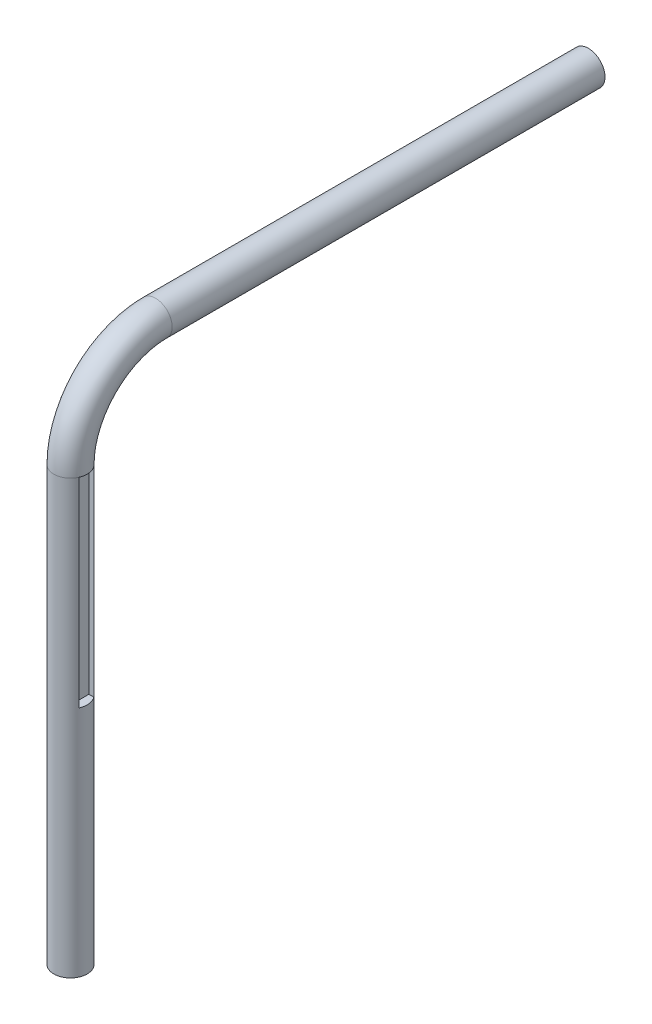
from build123d import *

# Parameters (mm, degrees)
SKETCH3_R           = 12.7
SKETCH3_R_2         = 4.7625
SKETCH4_R           = 12.7
SKETCH4_R_2         = 4.7625
BOSS_EXTRUDE3_DEPTH = 330.2
SKETCH5_R           = 12.7
SKETCH5_R_2         = 4.7625
BOSS_EXTRUDE4_DEPTH = 330.2
SKETCH7_W           = 12.7
SKETCH7_H           = 152.4
CUT_EXTRUDE2_DEPTH  = 6.35


with BuildPart() as part:
    # Sweep1: sweep along a path in Sketch2
    with BuildLine(Plane(origin=(0, 0, 0), x_dir=(0, 0, -1), z_dir=(1, 0, 0))) as sweep1_path:
        ThreePointArc((-64.833774642, 0), (-45.844401699, 45.844401699), (0, 64.833774642))
    # Sketch3 → Sweep1 (sweep)
    with BuildSketch(Plane(origin=(0, 0, 0), x_dir=(1, 0, 0), z_dir=(0, 1, 0))):
        with Locations((0, -64.833774642)):
            Circle(SKETCH3_R)
        with Locations((0, -64.833774642)):
            Circle(SKETCH3_R_2, mode=Mode.SUBTRACT)
    sweep(path=sweep1_path.line)

    # Sketch4 → Boss-Extrude3 (add)
    with BuildSketch(Plane(origin=(0, 0, 0), x_dir=(-1, 0, 0), z_dir=(0, -1, 0))):
        with Locations((0, -64.833774642)):
            Circle(SKETCH4_R)
        with Locations((0, -64.833774642)):
            Circle(SKETCH4_R_2, mode=Mode.SUBTRACT)
    extrude(amount=BOSS_EXTRUDE3_DEPTH)

    # Sketch5 → Boss-Extrude4 (add)
    with BuildSketch(Plane(origin=(0, 0, 0), x_dir=(-1, 0, 0), z_dir=(0, 0, -1))):
        with Locations((0, 64.833774642)):
            Circle(SKETCH5_R)
        with Locations((0, 64.833774642)):
            Circle(SKETCH5_R_2, mode=Mode.SUBTRACT)
    extrude(amount=BOSS_EXTRUDE4_DEPTH)

    # Sketch7 → Cut-Extrude2 (cut)
    with BuildSketch(Plane(origin=(12.7, 0, 0), x_dir=(0, 0, -1), z_dir=(1, 0, 0))):
        with Locations((-63.5, -76.2)):
            Rectangle(SKETCH7_W, SKETCH7_H)
    extrude(amount=-CUT_EXTRUDE2_DEPTH, mode=Mode.SUBTRACT)


solid = part.part
